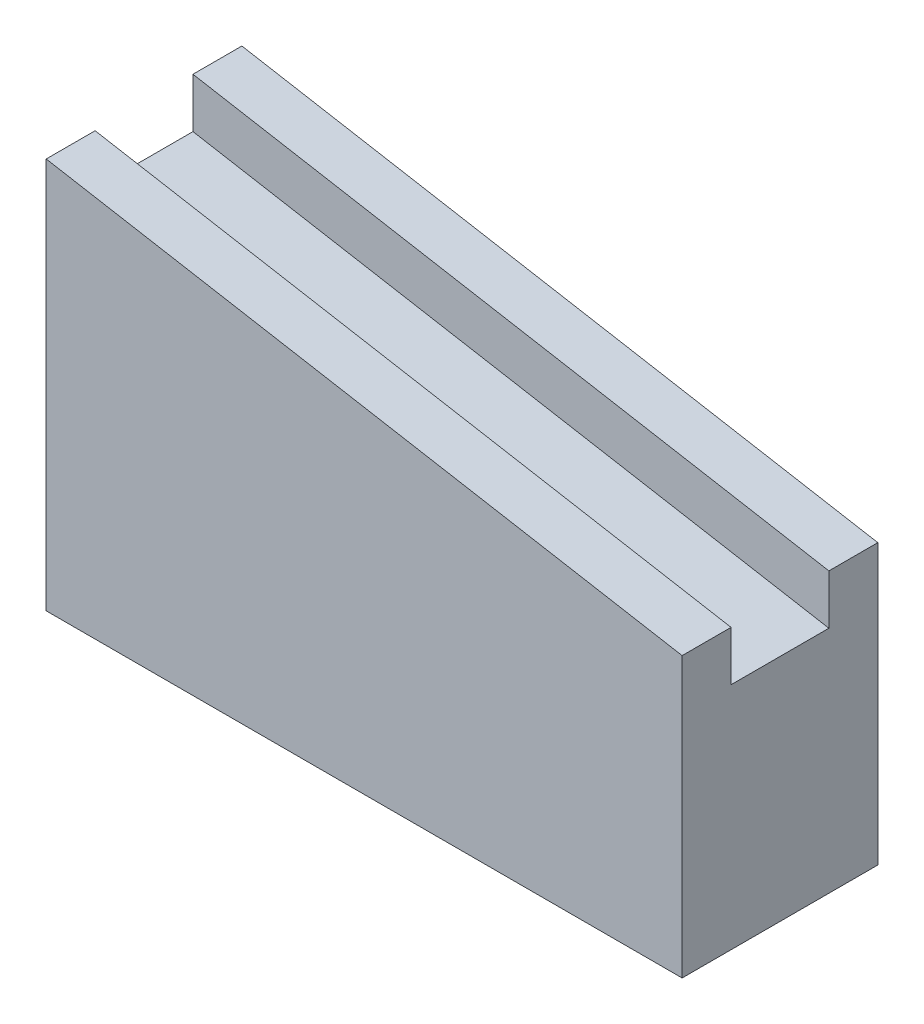
from build123d import *

# Parameters (mm, degrees)
RESSALTO_EXTRUS_O1_DEPTH = 40
ESBO_O3_W                = 141.516262768
ESBO_O3_H                = 20
CORTE_EXTRUS_O2_DEPTH    = 10


with BuildPart() as part:
    # Esboço1 → Ressalto-extrusão1 (new body)
    with BuildSketch(Plane.XY):
        Polygon((-53.29532416, 9.300830565), (76.70467584, 9.300830565), (76.70467584, 66.378323073), (-53.29532416, 89.300830565), align=None)
    extrude(amount=RESSALTO_EXTRUS_O1_DEPTH)

    # Esboço3 → Corte-extrusão2 (cut)
    with BuildSketch(Plane(origin=(13.664290772, 77.494043834, 0), x_dir=(0.9848077530122075, -0.17364817766693377, 0), z_dir=(0.1736481776669338, 0.9848077530122076, 0))):
        with Locations((-0.261929855, -20)):
            Rectangle(ESBO_O3_W, ESBO_O3_H)
    extrude(amount=-CORTE_EXTRUS_O2_DEPTH, mode=Mode.SUBTRACT)


solid = part.part
